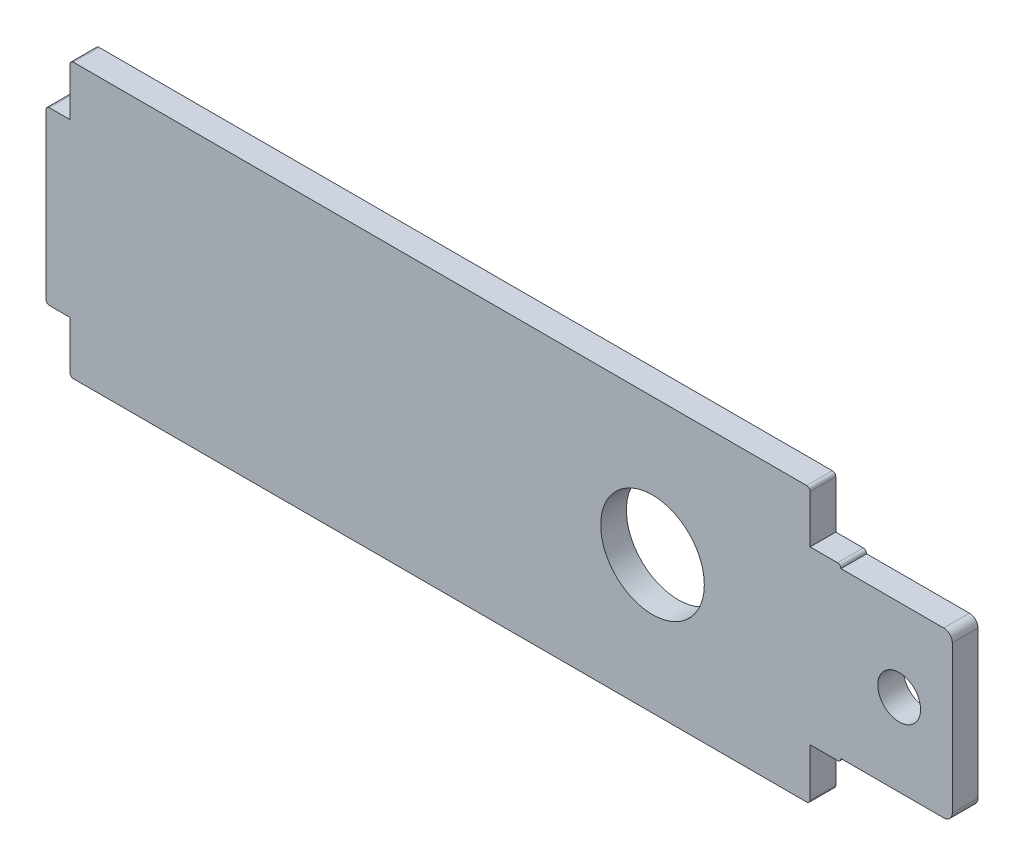
from build123d import *

# Parameters (mm, degrees)
SKETCH1_R          = 3.025
BASE_FLANGE1_DEPTH = 1.5
SKETCH6_R          = 1.25
TAB1_DEPTH         = 1.5


# Sheet-metal steps are written as plain solids
with BuildPart() as part:
    # Sketch1 → Base-Flange1 (new body)
    with BuildSketch(Plane.XY):
        with BuildLine():
            Line((1.4, 17.8), (1.4, 15))
            Line((1.4, 15), (0.2, 15))
            ThreePointArc((0.2, 15), (0.058578644, 14.941421356), (0, 14.8))
            Line((0, 14.8), (0, 5.2))
            ThreePointArc((0, 5.2), (0.058578644, 5.058578644), (0.2, 5))
            Line((0.2, 5), (1.4, 5))
            Line((1.4, 5), (1.4, 2.2))
            ThreePointArc((1.4, 2.2), (1.458578644, 2.058578644), (1.6, 2))
            Line((1.6, 2), (44.4, 2))
            ThreePointArc((44.4, 2), (44.541421356, 2.058578644), (44.6, 2.2))
            Line((44.6, 2.2), (44.6, 5))
            Line((44.6, 5), (46.2, 5))
            ThreePointArc((46.2, 5), (46.341421356, 5.058578644), (46.4, 5.2))
            Line((46.4, 5.2), (46.4, 14.8))
            ThreePointArc((46.4, 14.8), (46.341421356, 14.941421356), (46.2, 15))
            Line((46.2, 15), (44.6, 15))
            Line((44.6, 15), (44.6, 17.8))
            ThreePointArc((44.6, 17.8), (44.541421356, 17.941421356), (44.4, 18))
            Line((44.4, 18), (1.6, 18))
            ThreePointArc((1.6, 18), (1.458578644, 17.941421356), (1.4, 17.8))
        make_face()
        with Locations((35.4, 10)):
            Circle(SKETCH1_R, mode=Mode.SUBTRACT)
    extrude(amount=-BASE_FLANGE1_DEPTH)

    # Sketch6 → Tab1 (add)
    with BuildSketch(Plane.XY):
        with BuildLine():
            Line((46.4, 14.8), (52.4, 14.8))
            ThreePointArc((52.4, 14.8), (52.753553391, 14.653553391), (52.9, 14.3))
            Line((52.9, 14.3), (52.9, 5.7))
            ThreePointArc((52.9, 5.7), (52.753553391, 5.346446609), (52.4, 5.2))
            Line((52.4, 5.2), (46.4, 5.2))
            Line((46.4, 5.2), (46.4, 14.8))
        make_face()
        with Locations((49.8, 10)):
            Circle(SKETCH6_R, mode=Mode.SUBTRACT)
    extrude(amount=-TAB1_DEPTH)


solid = part.part
